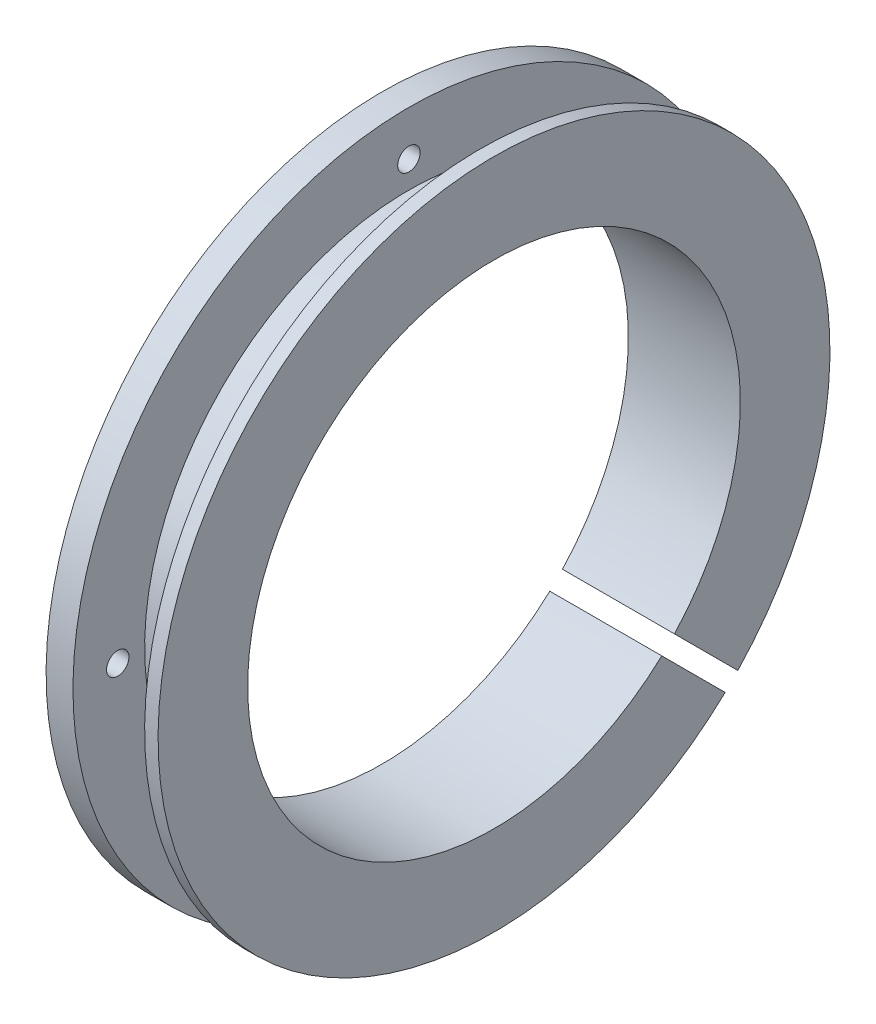
from build123d import *

# Parameters (mm, degrees)
M3X0_5_TAPPED_HOLE1_D     = 2.5
M3X0_5_TAPPED_HOLE1_DEPTH = 7.5
M3X0_5_TAPPED_HOLE1_TIP   = 0.751075774
CUT_EXTRUDE1_DEPTH        = 55.486236794


with BuildPart() as part:
    # Sketch1 → Revolve1 (revolve)
    with BuildSketch(Plane.XY):
        Polygon((-12.5, 27.5), (0, 27.5), (0, 37.5), (-1.5, 37.5), (-1.5, 29.5), (-9.5, 29.5), (-9.5, 37.5), (-12.5, 37.5), align=None)
    revolve(axis=Axis((0, 0, 0), (-1, 0, 0)))

    # M3x0.5 Tapped Hole1
    with Locations(Plane.ZY.offset(12.5)):
        with Locations((0, -32.5), (-32.5, 0), (32.5, 0), (0, 32.5)):
            Hole(M3X0_5_TAPPED_HOLE1_D / 2, depth=M3X0_5_TAPPED_HOLE1_DEPTH)
            with Locations((0, 0, -(M3X0_5_TAPPED_HOLE1_DEPTH + M3X0_5_TAPPED_HOLE1_TIP / 2))):  # 118° drill point
                Cone(0, M3X0_5_TAPPED_HOLE1_D / 2, M3X0_5_TAPPED_HOLE1_TIP, mode=Mode.SUBTRACT)

    # Sketch6 → Cut-Extrude1 (cut, through all)
    with BuildSketch(Plane(origin=(0, 0, 0), x_dir=(0, 0, -1), z_dir=(1, 0, 0))):
        Polygon((27.223611076, -25.809397513), (25.809397513, -27.223611076), (18.725468962, -20.139682524), (20.139682524, -18.725468962), align=None)
    extrude(amount=-CUT_EXTRUDE1_DEPTH, mode=Mode.SUBTRACT)


solid = part.part
